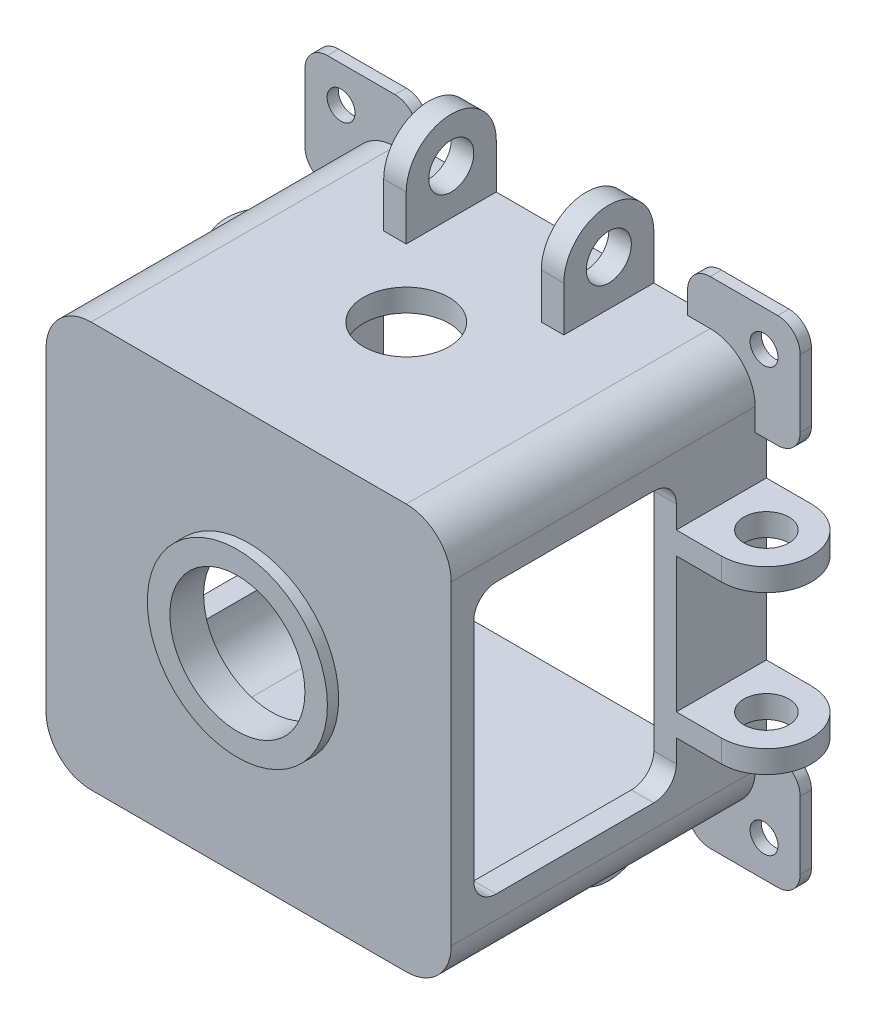
from build123d import *

# Parameters (mm, degrees)
EXTRUDE_1_DEPTH          = 70
SKETCH_3_R               = 9.5
CUT_EXTRUDE_2_DEPTH      = 123.576506721
SKETCH_4_R               = 5
EXTRUDE_2_DEPTH          = 20
SKETCH_5_W               = 30
SKETCH_5_H               = 30
CUT_EXTRUDE_3_DEPTH      = 106.59356041
PATTERN_CIRCULAR_3_COUNT = 4
SKETCH_13_W              = 80
SKETCH_13_H              = 80
SKETCH_13_R              = 15
EXTRUDE_3_DEPTH          = 5
EXTRUDE_4_DEPTH          = 2.5
EXTRUDE_4_DEPTH_BACK     = 7.5
SKETCH_14_R              = 20
SKETCH_14_R_2            = 15
SKETCH_15_R              = 3.1
EXTRUDE_5_DEPTH          = 2.5
MIRROR_3_COPY_1_SKETCH_R = 3.1
MIRROR_3_COPY_1_DEPTH    = 2.5
MIRROR_3_COPY_2_SKETCH_R = 3.1
MIRROR_3_COPY_2_DEPTH    = 2.5
CUT_EXTRUDE_6_DEPTH      = 147.905581923


with BuildPart() as part:
    # 草图1 → 凸台-拉伸1 (new body)
    with BuildSketch(Plane.XY):
        with BuildLine():
            Line((-35, -45), (35, -45))
            ThreePointArc((35, -45), (42.071067812, -42.071067812), (45, -35))
            Line((45, -35), (45, 35))
            ThreePointArc((45, 35), (42.071067812, 42.071067812), (35, 45))
            Line((35, 45), (-35, 45))
            ThreePointArc((-35, 45), (-42.071067812, 42.071067812), (-45, 35))
            Line((-45, 35), (-45, -35))
            ThreePointArc((-45, -35), (-42.071067812, -42.071067812), (-35, -45))
        make_face()
        with BuildLine():
            Line((-30, -40), (30, -40))
            ThreePointArc((30, -40), (37.071067812, -37.071067812), (40, -30))
            Line((40, -30), (40, 30))
            ThreePointArc((40, 30), (37.071067812, 37.071067812), (30, 40))
            Line((30, 40), (-30, 40))
            ThreePointArc((-30, 40), (-37.071067812, 37.071067812), (-40, 30))
            Line((-40, 30), (-40, -30))
            ThreePointArc((-40, -30), (-37.071067812, -37.071067812), (-30, -40))
        make_face(mode=Mode.SUBTRACT)
    extrude(amount=EXTRUDE_1_DEPTH)

    # 草图3 → 切除-拉伸2 (cut, through all)
    with BuildSketch(Plane(origin=(0, 45, 0), x_dir=(1, 0, 0), z_dir=(0, 1, 0))):
        with Locations((0, -35)):
            Circle(SKETCH_3_R)
    extrude(amount=-CUT_EXTRUDE_2_DEPTH, mode=Mode.SUBTRACT)

    # 草图4 → 凸台-拉伸2 (add, symmetric)
    with BuildSketch(Plane(origin=(0, -1.997656421, 74.265247584), x_dir=(0, 0, -1), z_dir=(1, 0, 0))):
        with BuildLine():
            Line((54.265247584, -43.002343579), (54.265247584, -53.002343579))
            ThreePointArc((54.265247584, -53.002343579), (64.265247584, -63.002343579), (74.265247584, -53.002343579))
            Line((74.265247584, -53.002343579), (74.265247584, -43.002343579))
            Line((74.265247584, -43.002343579), (54.265247584, -43.002343579))
        make_face()
        with Locations((64.265247584, -53.002343579)):
            Circle(SKETCH_4_R, mode=Mode.SUBTRACT)
    extrude_2 = extrude(amount=EXTRUDE_2_DEPTH, both=True)

    # 草图5 → 切除-拉伸3 (cut, through all)
    with BuildSketch(Plane(origin=(0, 0, 0), x_dir=(-1, 0, 0), z_dir=(0, 0, -1))):
        with Locations((0, -60)):
            Rectangle(SKETCH_5_W, SKETCH_5_H)
    cut_extrude_3 = extrude(amount=-CUT_EXTRUDE_3_DEPTH, mode=Mode.SUBTRACT)

    # 阵列(圆周)3: 凸台-拉伸2, 切除-拉伸3 ×4 about axis
    pattern_circular_3_axis = Axis((0, 0, 63), (0, 0, -1))
    add([extrude_2.rotate(pattern_circular_3_axis, i * 360 / PATTERN_CIRCULAR_3_COUNT) for i in range(1, PATTERN_CIRCULAR_3_COUNT)])
    add([cut_extrude_3.rotate(pattern_circular_3_axis, i * 360 / PATTERN_CIRCULAR_3_COUNT) for i in range(1, PATTERN_CIRCULAR_3_COUNT)], mode=Mode.SUBTRACT)

    # 草图13 → 凸台-拉伸3 (add)
    with BuildSketch(Plane.XY.offset(70)):
        Rectangle(SKETCH_13_W, SKETCH_13_H)
        Circle(SKETCH_13_R, mode=Mode.SUBTRACT)
    extrude(amount=-EXTRUDE_3_DEPTH)

    # 草图14 → 凸台-拉伸4 (add, two sides: drawn at the far end of the back side and taken through both)
    with BuildSketch(Plane.XY.offset(70).offset(-EXTRUDE_4_DEPTH_BACK)):
        Circle(SKETCH_14_R)
        Circle(SKETCH_14_R_2, mode=Mode.SUBTRACT)
    extrude(amount=EXTRUDE_4_DEPTH + EXTRUDE_4_DEPTH_BACK)

    # 草图15 → 凸台-拉伸5 (add)
    with BuildSketch(Plane(origin=(0, 0, 0), x_dir=(-1, 0, 0), z_dir=(0, 0, -1))):
        with BuildLine():
            Line((-40, 30), (-50, 30))
            ThreePointArc((-50, 30), (-53.535533906, 31.464466094), (-55, 35))
            Line((-55, 35), (-55, 50))
            ThreePointArc((-55, 50), (-53.535533906, 53.535533906), (-50, 55))
            Line((-50, 55), (-35, 55))
            ThreePointArc((-35, 55), (-31.464466094, 53.535533906), (-30, 50))
            Line((-30, 50), (-30, 40))
            ThreePointArc((-30, 40), (-37.071067812, 37.071067812), (-40, 30))
        make_face()
        with Locations((-46.970562748, 46.970562748)):
            Circle(SKETCH_15_R, mode=Mode.SUBTRACT)
    extrude_5 = extrude(amount=-EXTRUDE_5_DEPTH)

    # 镜向2: 凸台-拉伸5 across plane
    add(extrude_5.mirror(Plane(origin=(0, 0, 0), x_dir=(0, 0, 1), z_dir=(1, 0, 0))))

    # 镜向3 copy 1 sketch → 镜向3 copy 1 (add)
    with BuildSketch(Plane(origin=(0, 0, 0), x_dir=(1, 0, 0), z_dir=(0, 0, -1))):
        with BuildLine():
            Line((-40, 30), (-50, 30))
            ThreePointArc((-50, 30), (-53.535533906, 31.464466094), (-55, 35))
            Line((-55, 35), (-55, 50))
            ThreePointArc((-55, 50), (-53.535533906, 53.535533906), (-50, 55))
            Line((-50, 55), (-35, 55))
            ThreePointArc((-35, 55), (-31.464466094, 53.535533906), (-30, 50))
            Line((-30, 50), (-30, 40))
            ThreePointArc((-30, 40), (-37.071067812, 37.071067812), (-40, 30))
        make_face()
        with Locations((-46.970562748, 46.970562748)):
            Circle(MIRROR_3_COPY_1_SKETCH_R, mode=Mode.SUBTRACT)
    extrude(amount=-MIRROR_3_COPY_1_DEPTH)

    # 镜向3 copy 2 sketch → 镜向3 copy 2 (add)
    with BuildSketch(Plane(origin=(0, 0, 0), x_dir=(-1, 0, 0), z_dir=(0, 0, -1))):
        with BuildLine():
            Line((-40, -30), (-50, -30))
            ThreePointArc((-50, -30), (-53.535533906, -31.464466094), (-55, -35))
            Line((-55, -35), (-55, -50))
            ThreePointArc((-55, -50), (-53.535533906, -53.535533906), (-50, -55))
            Line((-50, -55), (-35, -55))
            ThreePointArc((-35, -55), (-31.464466094, -53.535533906), (-30, -50))
            Line((-30, -50), (-30, -40))
            ThreePointArc((-30, -40), (-37.071067812, -37.071067812), (-40, -30))
        make_face()
        with Locations((-46.970562748, -46.970562748)):
            Circle(MIRROR_3_COPY_2_SKETCH_R, mode=Mode.SUBTRACT)
    extrude(amount=-MIRROR_3_COPY_2_DEPTH)

    # 草图16 → 切除-拉伸6 (cut, through all)
    with BuildSketch(Plane.ZY.offset(45)):
        with BuildLine():
            Line((25, 30), (60, 30))
            ThreePointArc((60, 30), (63.535533906, 28.535533906), (65, 25))
            Line((65, 25), (65, -25))
            ThreePointArc((65, -25), (63.535533906, -28.535533906), (60, -30))
            Line((60, -30), (25, -30))
            ThreePointArc((25, -30), (21.464466094, -28.535533906), (20, -25))
            Line((20, -25), (20, 25))
            ThreePointArc((20, 25), (21.464466094, 28.535533906), (25, 30))
        make_face()
    extrude(amount=-CUT_EXTRUDE_6_DEPTH, mode=Mode.SUBTRACT)


solid = part.part
